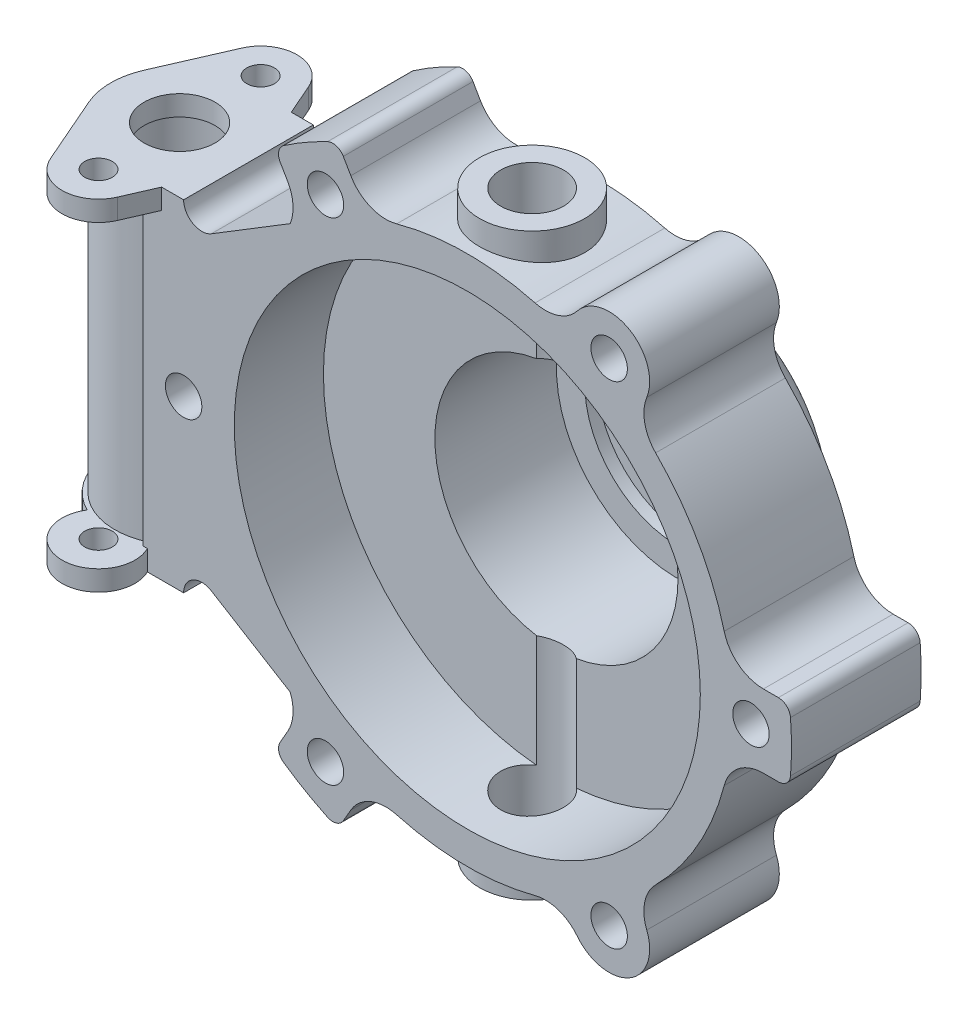
from build123d import *

# Parameters (mm, degrees)
SKETCH_1_R                 = 65.5
EXTRUDE_1_DEPTH            = 32
SKETCH_4_R                 = 50
EXTRUDE_2_DEPTH            = 5
SKETCH_5_R                 = 36
EXTRUDE_3_DEPTH            = 22
FILLET_1_R                 = 10
SKETCH_6_R                 = 16
EXTRUDE_4_DEPTH            = 42
SKETCH_7_R                 = 17
EXTRUDE_5_DEPTH            = 5
EXTRUDE_6_DEPTH            = 32
SKETCH_9_R                 = 57.5
CUT_EXTRUDE_1_DEPTH        = 22
SKETCH_13_R                = 30
CUT_EXTRUDE_2_DEPTH        = 30
SKETCH_14_R                = 23
CUT_EXTRUDE_3_DEPTH        = 3
SKETCH_16_R                = 17.5
CUT_EXTRUDE_5_DEPTH        = 136.063873778
EXTRUDE_7_REACH            = 209.835
EXTRUDE_7_END_RADIUS       = 65.5
EXTRUDE_START              = 71.5
SKETCH_17_R                = 13
HOLE_WIZARD_M18_1_D        = 15.5
EXTRUDE_8_DEPTH            = 32
PATTERN_CIRCULAR_1_COUNT   = 3
FILLET_2_R                 = 3
EXTRUDE_9_DEPTH            = 32
PATTERN_CIRCULAR_2_COUNT   = 3
SKETCH_22_R                = 4.5
CUT_EXTRUDE_6_DEPTH        = 140.823189794
PATTERN_CIRCULAR_3_COUNT   = 6
SKETCH_23_R                = 11.5
CUT_EXTRUDE_7_DEPTH        = 28
HOLE_WIZARD_M20_1_D        = 17.5
HOLE_WIZARD_M20_1_DEPTH    = 20
HOLE_WIZARD_M20_1_TIP      = 5.257530416
SKETCH_26_R                = 4
CUT_EXTRUDE_8_DEPTH        = 166.538349737
EXTRUDE_START_2            = -5
SKETCH_31_R                = 8.75
EXTRUDE_10_DEPTH           = 5
HOLE_WIZARD_M8_1_D         = 6.8
SKETCH_34_R                = 9
EXTRUDE_11_DEPTH           = 5
HOLE_START                 = -42
HOLE_WIZARD_M8_2_OUTLINE_R = 3.4
HOLE_WIZARD_M8_2_DEPTH     = 5


# Read off the part's stored shape, not the designer's step: M8 螺纹孔2
with BuildPart() as part:
    # 草图1 → 凸台-拉伸1 (new body)
    with BuildSketch(Plane.XY):
        Circle(SKETCH_1_R)
    extrude(amount=-EXTRUDE_1_DEPTH)

    # 草图4 → 凸台-拉伸2 (add)
    with BuildSketch(Plane(origin=(0, 0, -32), x_dir=(-1, 0, 0), z_dir=(0, 0, -1))):
        Circle(SKETCH_4_R)
    extrude(amount=EXTRUDE_2_DEPTH)

    # 草图5 → 凸台-拉伸3 (add)
    with BuildSketch(Plane(origin=(0, 0, -37), x_dir=(-1, 0, 0), z_dir=(0, 0, -1))):
        Circle(SKETCH_5_R)
    extrude(amount=EXTRUDE_3_DEPTH)

    # 圆角1
    fillet_1_edges = [part.edges().sort_by_distance(p)[0] for p in [
        (36, 0, -59),
    ]]
    fillet(fillet_1_edges, radius=FILLET_1_R)



with BuildPart() as body_2:
    # 草图6 → 凸台-拉伸4 (new, symmetric)
    with BuildSketch(Plane(origin=(0, 0, 0), x_dir=(1, 0, 0), z_dir=(0, 1, 0))):
        with Locations(Location((-87, 16, 0), (0, 0, 90))):
            Circle(SKETCH_6_R)
    extrude(amount=EXTRUDE_4_DEPTH, both=True)

    # 草图7 → 凸台-拉伸5 (add)
    with BuildSketch(Plane(origin=(0, 42, 0), x_dir=(1, 0, 0), z_dir=(0, 1, 0))):
        with Locations(Location((-87, 16, 0), (0, 0, 270))):
            Circle(SKETCH_7_R)
    extrude_5 = extrude(amount=-EXTRUDE_5_DEPTH)

    # 镜向3: 凸台-拉伸5 across plane
    add(extrude_5.mirror(Plane.ZX))


with BuildPart() as part_1:
    add(part.part)

    add(body_2.part)  # 凸台-拉伸6 merges body 2
    # 草图8 → 凸台-拉伸6 (add)
    with BuildSketch(Plane.XY):
        with BuildLine():
            Line((-80, 0), (-65.5, 0))
            ThreePointArc((-65.5, 0), (-57.132193802, 32.033770172), (-34.166795988, 55.882734829))
            Line((-34.166795988, 55.882734829), (-63.152662871, 38.160728142))
            ThreePointArc((-63.152662871, 38.160728142), (-67.700793371, 38.074887449), (-70, 42))
            Line((-70, 42), (-80, 42))
            Line((-80, 42), (-80, 0))
        make_face()
        with BuildLine():
            ThreePointArc((-70, -42), (-67.700793371, -38.074887449), (-63.152662871, -38.160728142))
            Line((-63.152662871, -38.160728142), (-34.166795988, -55.882734829))
            ThreePointArc((-34.166795988, -55.882734829), (-57.132193802, -32.033770172), (-65.5, 0))
            Line((-65.5, 0), (-80, 0))
            Line((-80, 0), (-80, -42))
            Line((-80, -42), (-70, -42))
        make_face()
    extrude(amount=-EXTRUDE_6_DEPTH)

    # 草图9 → 切除-拉伸1 (cut)
    with BuildSketch(Plane.XY):
        Circle(SKETCH_9_R)
    extrude(amount=-CUT_EXTRUDE_1_DEPTH, mode=Mode.SUBTRACT)

    # 草图13 → 切除-拉伸2 (cut)
    with BuildSketch(Plane.XY.offset(-22)):
        Circle(SKETCH_13_R)
    extrude(amount=-CUT_EXTRUDE_2_DEPTH, mode=Mode.SUBTRACT)

    # 草图14 → 切除-拉伸3 (cut)
    with BuildSketch(Plane.XY.offset(-52)):
        Circle(SKETCH_14_R)
    extrude(amount=-CUT_EXTRUDE_3_DEPTH, mode=Mode.SUBTRACT)

    # 草图16 → 切除-拉伸5 (cut, through all)
    with BuildSketch(Plane.XY.offset(-55)):
        Circle(SKETCH_16_R)
    extrude(amount=-CUT_EXTRUDE_5_DEPTH, mode=Mode.SUBTRACT)

    # 凸台-拉伸7: up to this cylinder (the profile starts outside it)
    extrude_7_end = Plane(origin=(0, 0, -16), z_dir=(0, 0, 1)) * Cylinder(EXTRUDE_7_END_RADIUS, 551.67, mode=Mode.PRIVATE)
    # 草图17 → 凸台-拉伸7 (add, up to the surface)
    with BuildSketch(Plane(origin=(0, 0, 0), x_dir=(1, 0, 0), z_dir=(0, 1, 0)).offset(EXTRUDE_START), mode=Mode.PRIVATE) as extrude_7_sk1:
        with Locations(Location((0, 16, 0), (0, 0, 270))):
            Circle(SKETCH_17_R)
    extrude_7_tool1 = extrude(extrude_7_sk1.sketch, amount=-EXTRUDE_7_REACH, mode=Mode.PRIVATE) - extrude_7_end
    extrude_7 = extrude_7_tool1.solids().sort_by_distance((0, 71.5, -16))[0]
    add(extrude_7)

    # 镜向4: 凸台-拉伸7 across plane
    add(extrude_7.mirror(Plane.ZX))

    # M18 螺纹孔1 (through all)
    with Locations(Plane(origin=(0, 71.5, 0), x_dir=(1, 0, 0), z_dir=(0, 1, 0))):
        with Locations((0, 16)):
            Hole(HOLE_WIZARD_M18_1_D / 2)

    # 草图20 → 凸台-拉伸8 (add)
    with BuildSketch(Plane.XY):
        with BuildLine():
            Line((79.492137976, -9), (73.070171753, -9))
            ThreePointArc((73.070171753, -9), (66.953210208, -11.089072023), (63.392003309, -16.483443709))
            ThreePointArc((63.392003309, -16.483443709), (65.5, 0), (63.392003309, 16.483443709))
            ThreePointArc((63.392003309, 16.483443709), (66.953210208, 11.089072023), (73.070171753, 9))
            Line((73.070171753, 9), (79.492137976, 9))
            ThreePointArc((79.492137976, 9), (80, 0), (79.492137976, -9))
        make_face()
    extrude_8 = extrude(amount=-EXTRUDE_8_DEPTH)

    # 阵列(圆周)1: 凸台-拉伸8 ×3 about axis
    pattern_circular_1_axis = Axis((0, 0, 0), (0, 0, 1))
    for i in range(1, PATTERN_CIRCULAR_1_COUNT):
        add(extrude_8.rotate(pattern_circular_1_axis, i * 360 / PATTERN_CIRCULAR_1_COUNT))

    # 圆角2
    fillet_2_edges = [part_1.edges().sort_by_distance(p)[0] for p in [
        (79.492137976, 9, -16),
        (79.492137976, -9, -16),
        (-47.540297622, 64.342210888, -16),
        (-31.951840354, 73.342210888, -16),
        (-31.951840354, -73.342210888, -16),
        (-47.540297622, -64.342210888, -16),
    ]]
    fillet(fillet_2_edges, radius=FILLET_2_R)

    # 草图21 → 凸台-拉伸9 (add)
    with BuildSketch(Plane.XY):
        with BuildLine():
            ThreePointArc((27.143415214, -66.808382786), (40, -69.282032303), (44.286049072, -56.911078514))
            ThreePointArc((44.286049072, -56.911078514), (43.773180226, -51.205082381), (46.476456005, -46.15397098))
            ThreePointArc((46.476456005, -46.15397098), (32.75, -56.724663948), (16.732283352, -63.326777068))
            ThreePointArc((16.732283352, -63.326777068), (22.458312032, -63.511227271), (27.143415214, -66.808382786))
        make_face()
    extrude_9 = extrude(amount=-EXTRUDE_9_DEPTH)

    # 阵列(圆周)2: 凸台-拉伸9 ×3 about axis
    pattern_circular_2_axis = Axis((0, 0, 0), (0, 0, 1))
    for i in range(1, PATTERN_CIRCULAR_2_COUNT):
        add(extrude_9.rotate(pattern_circular_2_axis, i * 360 / PATTERN_CIRCULAR_2_COUNT))

    # 草图22 → 切除-拉伸6 (cut, through all)
    with BuildSketch(Plane.XY):
        with Locations((70, 0)):
            Circle(SKETCH_22_R)
    cut_extrude_6 = extrude(amount=-CUT_EXTRUDE_6_DEPTH, mode=Mode.SUBTRACT)

    # 阵列(圆周)3: 切除-拉伸6 ×6 about axis
    pattern_circular_3_axis = Axis((0, 0, 0), (0, 0, 1))
    for i in range(1, PATTERN_CIRCULAR_3_COUNT):
        add(cut_extrude_6.rotate(pattern_circular_3_axis, i * 360 / PATTERN_CIRCULAR_3_COUNT), mode=Mode.SUBTRACT)

    # 草图23 → 切除-拉伸7 (cut)
    with BuildSketch(Plane(origin=(0, 42, 0), x_dir=(1, 0, 0), z_dir=(0, 1, 0))):
        with Locations(Location((-87, 16, 0), (0, 0, 270))):
            Circle(SKETCH_23_R)
    extrude(amount=-CUT_EXTRUDE_7_DEPTH, mode=Mode.SUBTRACT)

    # M20 螺纹孔1
    with Locations(Plane(origin=(0, 14, 0), x_dir=(1, 0, 0), z_dir=(0, 1, 0))):
        with Locations((-87, 16)):
            Hole(HOLE_WIZARD_M20_1_D / 2, depth=HOLE_WIZARD_M20_1_DEPTH)
            with Locations((0, 0, -(HOLE_WIZARD_M20_1_DEPTH + HOLE_WIZARD_M20_1_TIP / 2))):  # 118° drill point
                Cone(0, HOLE_WIZARD_M20_1_D / 2, HOLE_WIZARD_M20_1_TIP, mode=Mode.SUBTRACT)

    # 草图26 → 切除-拉伸8 (cut, through all)
    with BuildSketch(Plane(origin=(0, 42, 0), x_dir=(1, 0, 0), z_dir=(0, 1, 0))):
        with Locations(Location((-87, 16, 0), (0, 0, 270))):
            Circle(SKETCH_26_R)
    extrude(amount=-CUT_EXTRUDE_8_DEPTH, mode=Mode.SUBTRACT)

    # 草图31 → 凸台-拉伸10 (add)
    with BuildSketch(Plane(origin=(0, 42, 0), x_dir=(1, 0, 0), z_dir=(0, 1, 0)).offset(EXTRUDE_START_2)):
        with BuildLine():
            Line((-95.248636251, 39.6), (-102.580757363, 22.8))
            ThreePointArc((-102.580757363, 22.8), (-104, 16), (-102.580757363, 9.2))
            Line((-102.580757363, 9.2), (-95.248636251, -7.6))
            ThreePointArc((-95.248636251, -7.6), (-87, -13), (-78.751363749, -7.6))
            Line((-78.751363749, -7.6), (-71.419242637, 9.2))
            ThreePointArc((-71.419242637, 9.2), (-70, 16), (-71.419242637, 22.8))
            Line((-71.419242637, 22.8), (-78.751363749, 39.6))
            ThreePointArc((-78.751363749, 39.6), (-87, 45), (-95.248636251, 39.6))
        make_face()
        with Locations(Location((-87, 16, 0), (0, 0, 270))):
            Circle(SKETCH_31_R, mode=Mode.SUBTRACT)
    extrude(amount=EXTRUDE_10_DEPTH)

    # M8 螺纹孔1 (through all)
    with Locations(Plane(origin=(0, 42, 0), x_dir=(1, 0, 0), z_dir=(0, 1, 0))):
        with Locations((-87, -4), (-87, 36)):
            Hole(HOLE_WIZARD_M8_1_D / 2)

    # 草图34 → 凸台-拉伸11 (add)
    with BuildSketch(Plane.XZ.offset(42)):
        with Locations((-87, 4)):
            Circle(SKETCH_34_R)
        with Locations((-87, -36)):
            Circle(SKETCH_34_R)
    extrude(amount=-EXTRUDE_11_DEPTH)

    # M8 螺纹孔2 outline → M8 螺纹孔2 (cut)
    with BuildSketch(Plane(origin=(0, 0, 0), x_dir=(1, 0, 0), z_dir=(0, 1, 0)).offset(HOLE_START)):
        with Locations((-87, 36)):
            Circle(HOLE_WIZARD_M8_2_OUTLINE_R)
        with Locations((-87, -4)):
            Circle(HOLE_WIZARD_M8_2_OUTLINE_R)
    extrude(amount=HOLE_WIZARD_M8_2_DEPTH, mode=Mode.SUBTRACT)


solid = part_1.part
